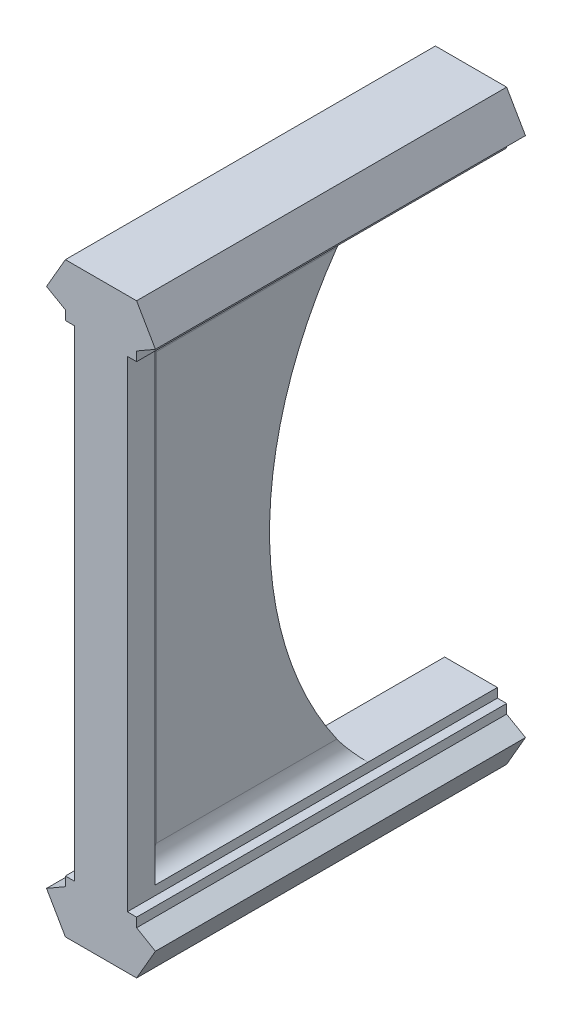
from build123d import *

# Parameters (mm, degrees)
BOSS_EXTRUDE1_DEPTH = 50.8
SKETCH2_W           = 7.239
SKETCH2_H           = 3.81
BOSS_EXTRUDE2_DEPTH = 63.5
RIB1_START          = -1.27
RIB1_DEPTH          = 2.54
FILLET1_R           = 2.54


# Read off the part's stored shape, not the designer's step: Rib1
with BuildPart() as part:
    # Sketch1 → Boss-Extrude1 (new body)
    with BuildSketch(Plane.XY):
        Polygon((3.6195, -31.75), (0, -31.75), (-3.6195, -31.75), (-3.6195, -33.02), (-4.8895, -33.02), (-4.8895, -34.29), (-4.8895, -40.259), (4.8895, -40.259), (4.8895, -34.29), (4.8895, -33.02), (3.6195, -33.02), align=None)
        Polygon((-4.8895, -40.259), (-4.8895, -34.29), (-7.474152818, -35.78225), align=None)
        Polygon((7.474152818, -35.78225), (4.8895, -34.29), (4.8895, -40.259), align=None)
        Polygon((-3.6195, 33.02), (-3.6195, 31.75), (0, 31.75), (3.6195, 31.75), (3.6195, 33.02), (4.8895, 33.02), (4.8895, 34.29), (4.8895, 40.259), (-4.8895, 40.259), (-4.8895, 34.29), (-4.8895, 33.02), align=None)
        Polygon((-7.474152818, 35.78225), (-4.8895, 34.29), (-4.8895, 40.259), align=None)
        Polygon((7.474152818, 35.78225), (4.8895, 40.259), (4.8895, 34.29), align=None)
    extrude(amount=-BOSS_EXTRUDE1_DEPTH)

    # Sketch2 → Boss-Extrude2 (add)
    with BuildSketch(Plane.XZ.offset(-31.75)):
        with Locations((0, -1.905)):
            Rectangle(SKETCH2_W, SKETCH2_H)
    extrude(amount=BOSS_EXTRUDE2_DEPTH)

    # Rib1 outline → Rib1 (add)
    with BuildSketch(Plane(origin=(0, 0, 0), x_dir=(0, 0, -1), z_dir=(1, 0, 0)).offset(RIB1_START)):
        with BuildLine():
            ThreePointArc((33.02, -31.75), (21.87573729, 0), (33.02, 31.75))
            Line((33.02, 31.75), (3.81, 31.75))
            Line((3.81, 31.75), (3.81, -31.75))
            Line((3.81, -31.75), (33.02, -31.75))
        make_face()
    extrude(amount=RIB1_DEPTH)

    # Fillet1
    # the kernel refuses this fillet: 2.54 mm, written as the material it adds along each edge
    with BuildSketch(Plane(origin=(-1.27, 31.75, -39.352115439), x_dir=(-1, 0, 0), z_dir=(0, 0, 1))) as fillet1_piece_1_section:
        with BuildLine():
            CenterArc((2.54, 2.532846176), FILLET1_R, 180, 85.698777695)
            Line((0, 2.532846176), (0, 0))
            Line((0, 0), (2.3495, 0))
        make_face()
    fillet1_piece_1 = extrude(amount=35.542115439, mode=Mode.PRIVATE)
    fillet1_piece_1 = fillet1_piece_1 - Plane(origin=(-1.944090085, 0, -72.675737291), x_dir=(0, -0.6249999999925505, 0.7806247498057642), z_dir=(-1, 0, 0)) * Cylinder(50.800000001, 82, mode=Mode.PRIVATE)
    add(fillet1_piece_1)
    with BuildSketch(Plane(origin=(-1.27, 38.082115439, -3.81), x_dir=(-1, 0, 0), z_dir=(0, -1, 0))) as fillet1_piece_2:
        with BuildLine():
            CenterArc((2.54, 2.532846176), FILLET1_R, 180, 85.698777695)
            Line((0, 2.532846176), (0, 0))
            Line((0, 0), (2.3495, 0))
        make_face()
    extrude(amount=76.164230879)
    with BuildSketch(Plane(origin=(-1.27, -31.75, -3.81), x_dir=(-1, 0, 0), z_dir=(0, 0, -1))) as fillet1_piece_3_section:
        with BuildLine():
            CenterArc((2.54, 2.532846176), FILLET1_R, 180, 85.698777695)
            Line((0, 2.532846176), (0, 0))
            Line((0, 0), (2.3495, 0))
        make_face()
    fillet1_piece_3 = extrude(amount=35.542115439, mode=Mode.PRIVATE)
    fillet1_piece_3 = fillet1_piece_3 - Plane(origin=(-1.944090085, 0, -72.675737291), x_dir=(0, -0.6249999999925505, 0.7806247498057642), z_dir=(-1, 0, 0)) * Cylinder(50.800000001, 82, mode=Mode.PRIVATE)
    add(fillet1_piece_3)
    with BuildSketch(Plane(origin=(1.27, 31.75, -39.352115439), x_dir=(1, 0, 0), z_dir=(0, 0, 1))) as fillet1_piece_4_section:
        with BuildLine():
            CenterArc((2.54, -2.532846176), FILLET1_R, 94.301222305, 85.698777695)
            Line((0, -2.532846176), (0, 0))
            Line((0, 0), (2.3495, 0))
        make_face()
    fillet1_piece_4 = extrude(amount=35.542115439, mode=Mode.PRIVATE)
    fillet1_piece_4 = fillet1_piece_4 - Plane(origin=(1.944090085, 0, -72.675737291), x_dir=(0, -0.6249999999925505, 0.7806247498057642), z_dir=(-1, 0, 0)) * Cylinder(50.800000001, 82, mode=Mode.PRIVATE)
    add(fillet1_piece_4)
    with BuildSketch(Plane(origin=(1.27, -31.75, -3.81), x_dir=(1, 0, 0), z_dir=(0, 0, -1))) as fillet1_piece_5_section:
        with BuildLine():
            CenterArc((2.54, -2.532846176), FILLET1_R, 94.301222305, 85.698777695)
            Line((0, -2.532846176), (0, 0))
            Line((0, 0), (2.3495, 0))
        make_face()
    fillet1_piece_5 = extrude(amount=35.542115439, mode=Mode.PRIVATE)
    fillet1_piece_5 = fillet1_piece_5 - Plane(origin=(1.944090085, 0, -72.675737291), x_dir=(0, -0.6249999999925505, 0.7806247498057642), z_dir=(-1, 0, 0)) * Cylinder(50.800000001, 82, mode=Mode.PRIVATE)
    add(fillet1_piece_5)
    with BuildSketch(Plane(origin=(1.27, 38.082115439, -3.81), x_dir=(0, 0, -1), z_dir=(0, -1, 0))) as fillet1_piece_6:
        with BuildLine():
            CenterArc((2.532846176, 2.54), FILLET1_R, 184.301222305, 85.698777695)
            Line((0, 2.3495), (0, 0))
            Line((0, 0), (2.532846176, 0))
        make_face()
    extrude(amount=76.164230879)


solid = part.part
